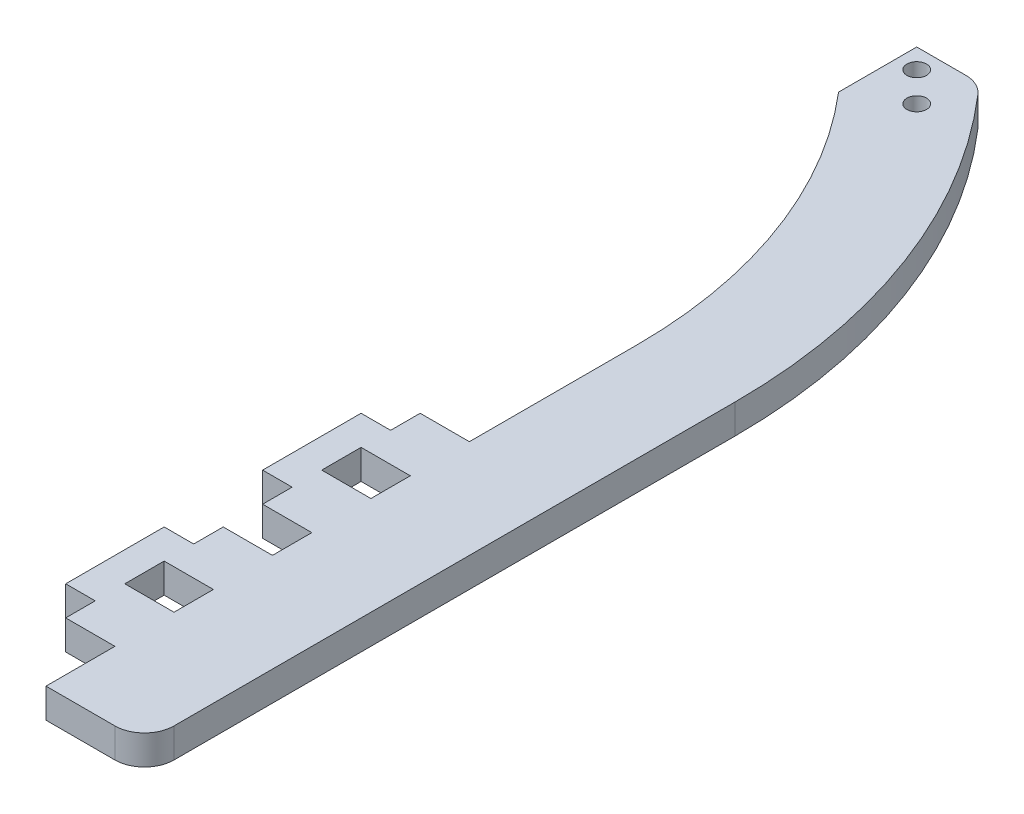
from build123d import *

# Parameters (mm, degrees)
SKETCH1_R              = 50
BOSS_EXTRUDE1_DEPTH    = 3
SPLIT1_SURFACE_1_BACK  = 170.732
SPLIT1_SURFACE_1_DEPTH = 341.464
SPLIT1_SURFACE_2_BACK  = 170.732
SPLIT1_SURFACE_2_DEPTH = 341.464
BODY_DELETE1_DEPTH     = 3
FILLET1_R              = 3
BOSS_EXTRUDE4_DEPTH    = 3
SPLIT2_SURFACE_3_BACK  = 109.724
SPLIT2_SURFACE_3_DEPTH = 219.448
SPLIT2_SURFACE_4_BACK  = 109.724
SPLIT2_SURFACE_4_DEPTH = 219.448
FILLET2_R              = 3
SKETCH5_R              = 1
CUT_EXTRUDE1_DEPTH     = 3
SKETCH6_W              = 8
SKETCH6_H              = 5
BOSS_EXTRUDE5_DEPTH    = 3
SKETCH7_W              = 5
SKETCH7_H              = 4
CUT_EXTRUDE2_DEPTH     = 3


# Read off the part's stored shape, not the designer's step: Body-Delete1
with BuildPart() as part:
    # Sketch1 → Boss-Extrude1 (new body)
    with BuildSketch(Plane(origin=(0, 0, 0), x_dir=(1, 0, 0), z_dir=(0, 1, 0))):
        with BuildLine():
            ThreePointArc((10, 0), (-107.445626465, 17.320508076), (0, -33.166247904))
            Line((0, -33.166247904), (0, -60))
            Line((0, -60), (10, -60))
            Line((10, -60), (10, 0))
        make_face()
        with Locations(Location((-50, 0, 0), (0, 0, 270))):
            Circle(SKETCH1_R, mode=Mode.SUBTRACT)
    extrude(amount=BOSS_EXTRUDE1_DEPTH)


with BuildPart() as body_2:
    # Split1: the piece behind the surface
    add(part.part)
    # Split1 surface: a surface, the sketch's curves swept straight by 341.464 mm
    with BuildLine(Plane(origin=(0, 3, 0), x_dir=(1, 0, 0), z_dir=(0, 1, 0)).offset(-SPLIT1_SURFACE_1_BACK), mode=Mode.PRIVATE) as split1_surface_1_path:
        Line((0, -33.166247904), (0, 0))
        Line((0, 0), (-12, 0))
        Line((-12, 0), (-12, 32.496153619))
        Line((-12, 32.496153619), (-12, 67.159700612))
        Line((-12, 67.159700612), (-127.638562935, 67.159700612))
        Line((-127.638562935, 67.159700612), (-127.638562935, -72.196904976))
        Line((-127.638562935, -72.196904976), (0, -72.196904976))
        Line((0, -72.196904976), (0, -33.166247904))
    split1_surface_1 = Shell.extrude(split1_surface_1_path.wire(), (0 * SPLIT1_SURFACE_1_DEPTH, 1 * SPLIT1_SURFACE_1_DEPTH, 0 * SPLIT1_SURFACE_1_DEPTH))
    split(bisect_by=split1_surface_1, keep=Keep.BOTTOM)

    # Fillet1
    fillet1_edges = [body_2.edges().sort_by_distance(p)[0] for p in [
        (10, 1.5, 60),
    ]]
    fillet(fillet1_edges, radius=FILLET1_R)

    # Sketch3 → Boss-Extrude4 (add)
    with BuildSketch(Plane(origin=(0, 3, 0), x_dir=(1, 0, 0), z_dir=(0, 1, 0))):
        Polygon((0, -50), (-8, -50), (-8, -40), (0, -40), (3, -40), (3, -50), align=None)
        Polygon((-8, -20), (-8, -30), (0, -30), (3, -30), (3, -20), (0, -20), align=None)
    extrude(amount=-BOSS_EXTRUDE4_DEPTH)


with BuildPart() as part_1:
    add(part.part)

    # Split1: split by a surface, the side it looks to stays
    # Split1 surface: a surface, the sketch's curves swept straight by 341.464 mm
    with BuildLine(Plane(origin=(0, 3, 0), x_dir=(1, 0, 0), z_dir=(0, 1, 0)).offset(-SPLIT1_SURFACE_2_BACK), mode=Mode.PRIVATE) as split1_surface_2_path:
        Line((0, -33.166247904), (0, 0))
        Line((0, 0), (-12, 0))
        Line((-12, 0), (-12, 32.496153619))
        Line((-12, 32.496153619), (-12, 67.159700612))
        Line((-12, 67.159700612), (-127.638562935, 67.159700612))
        Line((-127.638562935, 67.159700612), (-127.638562935, -72.196904976))
        Line((-127.638562935, -72.196904976), (0, -72.196904976))
        Line((0, -72.196904976), (0, -33.166247904))
    split1_surface_2 = Shell.extrude(split1_surface_2_path.wire(), (0 * SPLIT1_SURFACE_2_DEPTH, 1 * SPLIT1_SURFACE_2_DEPTH, 0 * SPLIT1_SURFACE_2_DEPTH))
    split(bisect_by=split1_surface_2, keep=Keep.TOP)

    # Body-Delete1 outline → Body-Delete1 (cut)
    with BuildSketch(Plane(origin=(0, 0, 0), x_dir=(1, 0, 0), z_dir=(0, 1, 0))):
        with BuildLine():
            ThreePointArc((-12, 46.432747065), (-109.329587897, -8.94427191), (0, -33.166247904))
            Line((0, -33.166247904), (0, 0))
            ThreePointArc((0, 0), (-96.904157598, -17.320508075), (-12, 32.496153619))
            Line((-12, 32.496153619), (-12, 46.432747065))
        make_face()
    extrude(amount=BODY_DELETE1_DEPTH, mode=Mode.SUBTRACT)


with BuildPart() as body_2_2:
    # Split2: the piece behind the surface
    add(body_2.part)
    # Split2 surface: a surface, the sketch's curves swept straight by 219.448 mm
    with BuildLine(Plane(origin=(0, 3, 0), x_dir=(1, 0, 0), z_dir=(0, 1, 0)).offset(-SPLIT2_SURFACE_3_BACK), mode=Mode.PRIVATE) as split2_surface_3_path:
        Line((-12, 40.432747065), (-5.669502994, 40.432747065))
        Line((-5.669502994, 40.432747065), (-5.042290504, 40.432747065))
        Line((-5.042290504, 40.432747065), (-5.042290504, 47.453598883))
        Line((-5.042290504, 47.453598883), (-14.646815791, 47.453598883))
        Line((-14.646815791, 47.453598883), (-14.646815791, 40.432747065))
        Line((-14.646815791, 40.432747065), (-12, 40.432747065))
    split2_surface_3 = Shell.extrude(split2_surface_3_path.wire(), (0 * SPLIT2_SURFACE_3_DEPTH, 1 * SPLIT2_SURFACE_3_DEPTH, 0 * SPLIT2_SURFACE_3_DEPTH))
    split(bisect_by=split2_surface_3, keep=Keep.BOTTOM)

    # Fillet2
    fillet2_edges = [body_2_2.edges().sort_by_distance(p)[0] for p in [
        (-5.669502994, 1.5, -40.432747065),
    ]]
    fillet(fillet2_edges, radius=FILLET2_R)

    # Sketch5 → Cut-Extrude1 (cut)
    with BuildSketch(Plane(origin=(0, 3, 0), x_dir=(1, 0, 0), z_dir=(0, 1, 0))):
        with Locations(Location((-10, 38.432747065, 0), (0, 0, 270))):
            Circle(SKETCH5_R)
        with Locations(Location((-7, 35.432747065, 0), (0, 0, 270))):
            Circle(SKETCH5_R)
    extrude(amount=-CUT_EXTRUDE1_DEPTH, mode=Mode.SUBTRACT)

    # Sketch6 → Boss-Extrude5 (add)
    with BuildSketch(Plane(origin=(0, 3, 0), x_dir=(1, 0, 0), z_dir=(0, 1, 0))):
        with Locations((-1, -39.5)):
            Rectangle(SKETCH6_W, SKETCH6_H)
        with Locations((-1, -50.5)):
            Rectangle(SKETCH6_W, SKETCH6_H)
        with Locations((-1, -19.5)):
            Rectangle(SKETCH6_W, SKETCH6_H)
        with Locations((-1, -30.5)):
            Rectangle(SKETCH6_W, SKETCH6_H)
    extrude(amount=-BOSS_EXTRUDE5_DEPTH)

    # Sketch7 → Cut-Extrude2 (cut)
    with BuildSketch(Plane(origin=(0, 3, 0), x_dir=(1, 0, 0), z_dir=(0, 1, 0))):
        with Locations((-2.5, -25)):
            Rectangle(SKETCH7_W, SKETCH7_H)
        with Locations((-2.5, -45)):
            Rectangle(SKETCH7_W, SKETCH7_H)
    extrude(amount=-CUT_EXTRUDE2_DEPTH, mode=Mode.SUBTRACT)


with BuildPart() as body_2_1:
    add(body_2.part)

    # Split2: split by a surface, the side it looks to stays
    # Split2 surface: a surface, the sketch's curves swept straight by 219.448 mm
    with BuildLine(Plane(origin=(0, 3, 0), x_dir=(1, 0, 0), z_dir=(0, 1, 0)).offset(-SPLIT2_SURFACE_4_BACK), mode=Mode.PRIVATE) as split2_surface_4_path:
        Line((-12, 40.432747065), (-5.669502994, 40.432747065))
        Line((-5.669502994, 40.432747065), (-5.042290504, 40.432747065))
        Line((-5.042290504, 40.432747065), (-5.042290504, 47.453598883))
        Line((-5.042290504, 47.453598883), (-14.646815791, 47.453598883))
        Line((-14.646815791, 47.453598883), (-14.646815791, 40.432747065))
        Line((-14.646815791, 40.432747065), (-12, 40.432747065))
    split2_surface_4 = Shell.extrude(split2_surface_4_path.wire(), (0 * SPLIT2_SURFACE_4_DEPTH, 1 * SPLIT2_SURFACE_4_DEPTH, 0 * SPLIT2_SURFACE_4_DEPTH))
    split(bisect_by=split2_surface_4, keep=Keep.TOP)


solid = body_2_2.part
